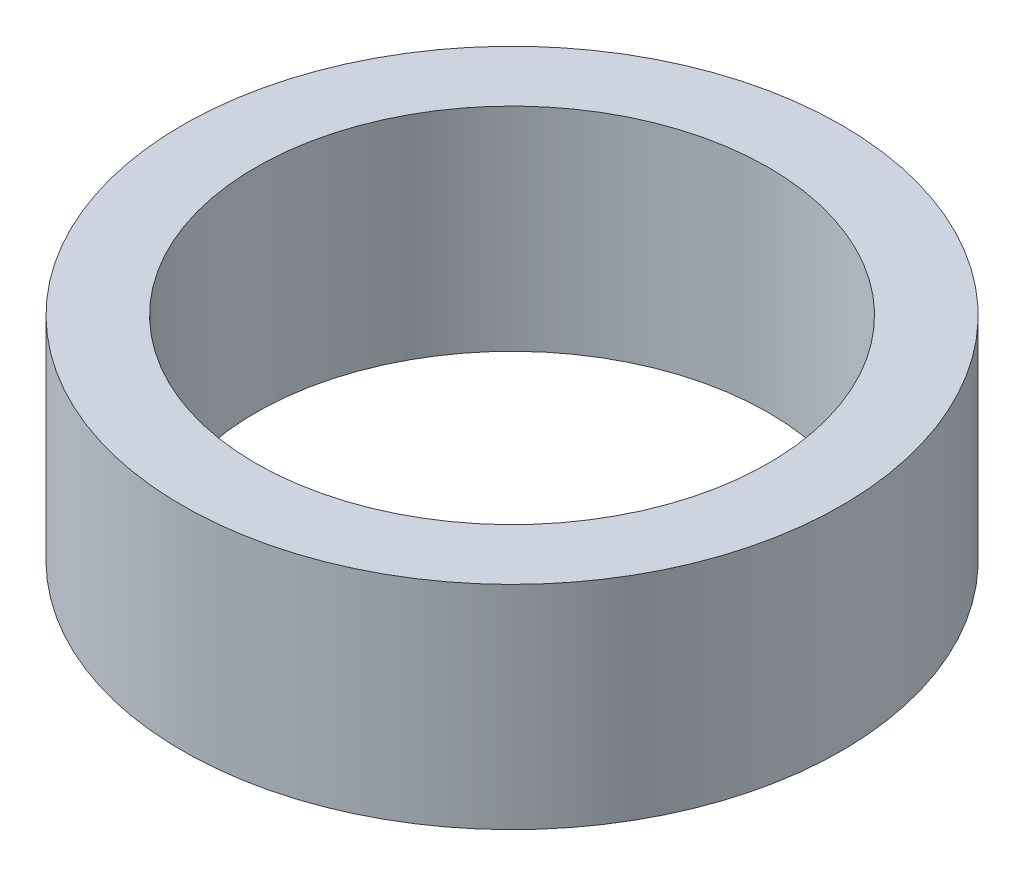
from build123d import *

# Parameters (mm, degrees)
SKETCH1_R           = 45
BOSS_EXTRUDE1_DEPTH = 29
SKETCH2_R           = 35
CUT_EXTRUDE1_DEPTH  = 70.93568474


with BuildPart() as part:
    # Sketch1 → Boss-Extrude1 (new body)
    with BuildSketch(Plane(origin=(0, 0, 0), x_dir=(1, 0, 0), z_dir=(0, 1, 0))):
        Circle(SKETCH1_R)
    extrude(amount=BOSS_EXTRUDE1_DEPTH)

    # Sketch2 → Cut-Extrude1 (cut, through all)
    with BuildSketch(Plane(origin=(0, 0, 0), x_dir=(1, 0, 0), z_dir=(0, 1, 0))):
        Circle(SKETCH2_R)
    extrude(amount=CUT_EXTRUDE1_DEPTH, mode=Mode.SUBTRACT)


solid = part.part
